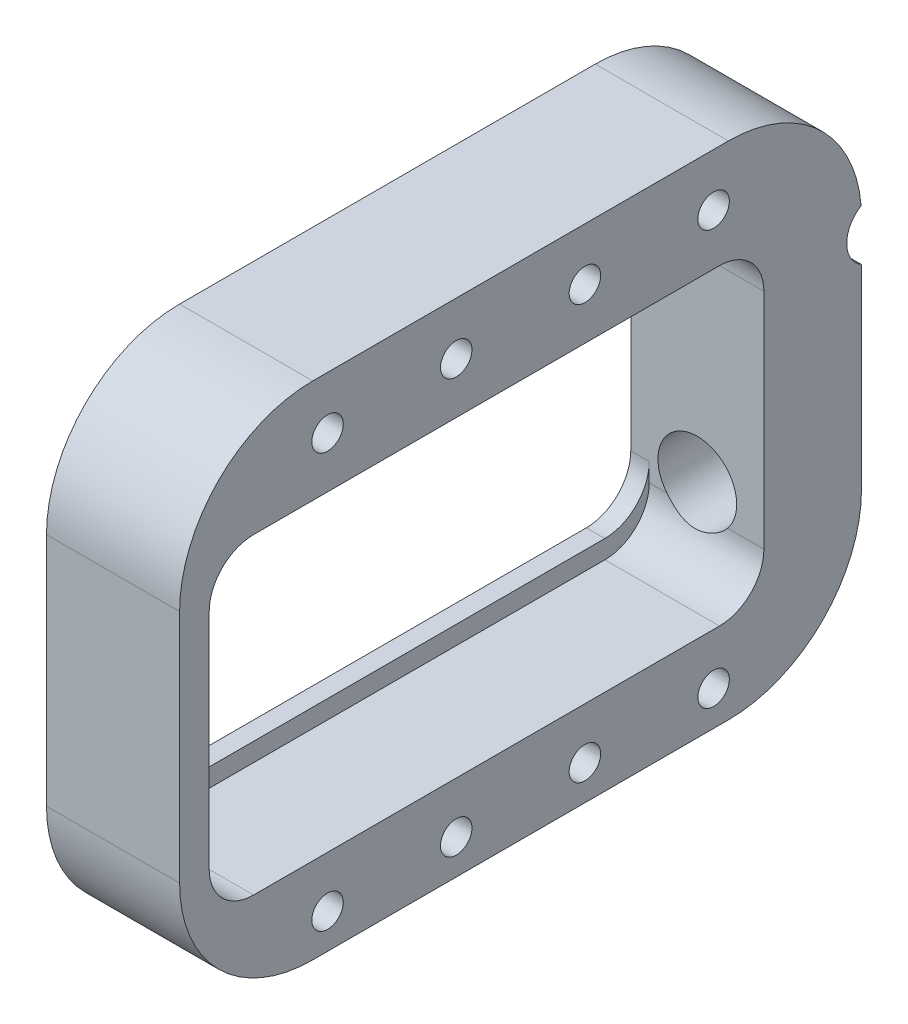
from build123d import *

# Parameters (mm, degrees)
SKETCH1_W                   = 58.547
SKETCH1_H                   = 44.577
SKETCH1_W_2                 = 47.625
SKETCH1_H_2                 = 26.797
BOSS_EXTRUDE1_DEPTH         = 5.715
BOSS_EXTRUDE2_REACH         = 57.19
SKETCH9_W                   = 1.5875
SKETCH9_H                   = 1.5875
FILLET11_R                  = 3.81
FILLET12_R                  = 3.81
SKETCH21_R                  = 2.54
CUT_EXTRUDE3_DEPTH          = 1.27
F_1_4_CLEARANCE_HOLE1_D     = 6.7564
F_1_4_CLEARANCE_HOLE1_DEPTH = 8.89
F_1_4_CLEARANCE_HOLE1_TIP   = 2.029827343
F_6_32_TAPPED_HOLE1_D       = 2.7051
SKETCH22_W                  = 58.547
SKETCH22_H                  = 7.441182991
CUT_EXTRUDE4_DEPTH          = 41.791028045
FILLET13_R                  = 11.43
FILLET14_R                  = 11.43


with BuildPart() as part:
    # Sketch1 → Boss-Extrude1 (new, symmetric)
    with BuildSketch(Plane(origin=(0, 0, 0), x_dir=(0, 0, -1), z_dir=(1, 0, 0))):
        with Locations((2.921, 0)):
            Rectangle(SKETCH1_W, SKETCH1_H)
        Rectangle(SKETCH1_W_2, SKETCH1_H_2, mode=Mode.SUBTRACT)
    extrude(amount=BOSS_EXTRUDE1_DEPTH, both=True)

    # Sketch9 → Boss-Extrude2 (add, up to next)
    with BuildSketch(Plane.XY.offset(-23.8125), mode=Mode.PRIVATE) as boss_extrude2_sk1:
        with Locations((-4.92125, 12.60475)):
            Rectangle(SKETCH9_W, SKETCH9_H)
    boss_extrude2_tool1 = extrude(boss_extrude2_sk1.sketch, amount=BOSS_EXTRUDE2_REACH, mode=Mode.PRIVATE) - part.part
    # Sketch9 → Boss-Extrude2 (add, up to next)
    with BuildSketch(Plane.XY.offset(-23.8125), mode=Mode.PRIVATE) as boss_extrude2_sk2:
        with Locations((-4.92125, -12.60475)):
            Rectangle(SKETCH9_W, SKETCH9_H)
    boss_extrude2_tool2 = extrude(boss_extrude2_sk2.sketch, amount=BOSS_EXTRUDE2_REACH, mode=Mode.PRIVATE) - part.part
    add(boss_extrude2_tool1.solids().sort_by_distance((-4.92125, 12.60475, -23.8125))[0])
    add(boss_extrude2_tool2.solids().sort_by_distance((-4.92125, -12.60475, -23.8125))[0])

    # Fillet11
    fillet11_edges = [part.edges().sort_by_distance(p)[0] for p in [
        (-4.92125, -11.811, 23.8125),
        (-4.92125, -11.811, -23.8125),
        (-4.92125, 11.811, 23.8125),
        (-4.92125, 11.811, -23.8125),
    ]]
    fillet(fillet11_edges, radius=FILLET11_R)

    # Fillet12
    fillet12_edges = [part.edges().sort_by_distance(p)[0] for p in [
        (0.79375, 13.3985, 23.8125),
        (0.79375, -13.3985, 23.8125),
        (0.79375, -13.3985, -23.8125),
        (0.79375, 13.3985, -23.8125),
    ]]
    fillet(fillet12_edges, radius=FILLET12_R)

    # Sketch21 → Cut-Extrude3 (cut)
    with BuildSketch(Plane(origin=(5.715, 0, 0), x_dir=(0, 0, -1), z_dir=(1, 0, 0))):
        with Locations((33.4645, 9.5885)):
            Circle(SKETCH21_R)
    extrude(amount=-CUT_EXTRUDE3_DEPTH, mode=Mode.SUBTRACT)

    # 1/4 Clearance Hole1
    with Locations(Plane(origin=(-2.530789808, 6.493019647, -32.1945), x_dir=(1, 0, 0), z_dir=(0, 0, -1))):
        with Locations((2.530789808, 13.922519647)):
            Hole(F_1_4_CLEARANCE_HOLE1_D / 2, depth=F_1_4_CLEARANCE_HOLE1_DEPTH)
            with Locations((0, 0, -(F_1_4_CLEARANCE_HOLE1_DEPTH + F_1_4_CLEARANCE_HOLE1_TIP / 2))):  # 118° drill point
                Cone(0, F_1_4_CLEARANCE_HOLE1_D / 2, F_1_4_CLEARANCE_HOLE1_TIP, mode=Mode.SUBTRACT)

    # #6-32 Tapped Hole1 (through all)
    with Locations(Plane(origin=(5.715, 17.955600219, 19.212274833), x_dir=(0, 0, 1), z_dir=(1, 0, 0))):
        with Locations((-27.657774833, 0.175600219), (-16.608774833, 0.175600219), (-5.559774833, 0.175600219), (-38.706774833, 0.175600219), (-38.706774833, 35.735600219), (-27.657774833, 35.735600219), (-16.608774833, 35.735600219), (-5.559774833, 35.735600219)):
            Hole(F_6_32_TAPPED_HOLE1_D / 2)

    # Sketch22 → Cut-Extrude4 (cut, through all)
    with BuildSketch(Plane(origin=(5.715, 0, 0), x_dir=(0, 0, -1), z_dir=(1, 0, 0))):
        with Locations((2.921, -24.485091496)):
            Rectangle(SKETCH22_W, SKETCH22_H)
    extrude(amount=-CUT_EXTRUDE4_DEPTH, mode=Mode.SUBTRACT)

    # Fillet13
    # the kernel refuses this fillet: 11.43 mm, written as the material it takes off along each edge
    with BuildSketch(Plane(origin=(34.29, 22.2885, -32.1945), x_dir=(0, -1, 0), z_dir=(-1, 0, 0)), Plane(origin=(34.29, -20.7645, -32.1945), x_dir=(0, 0, 1), z_dir=(-1, 0, 0))) as fillet13_piece_1:
        with BuildLine():
            CenterArc((FILLET13_R, FILLET13_R), FILLET13_R, 180, 90)
            Line((0, FILLET13_R), (0, 0))
            Line((0, 0), (FILLET13_R, 0))
        make_face()
    extrude(amount=68.58, mode=Mode.SUBTRACT)

    # Fillet14
    fillet14_edges = [part.edges().sort_by_distance(p)[0] for p in [
        (0, -20.7645, 26.3525),
        (0, 22.2885, 26.3525),
    ]]
    fillet(fillet14_edges, radius=FILLET14_R)


solid = part.part
